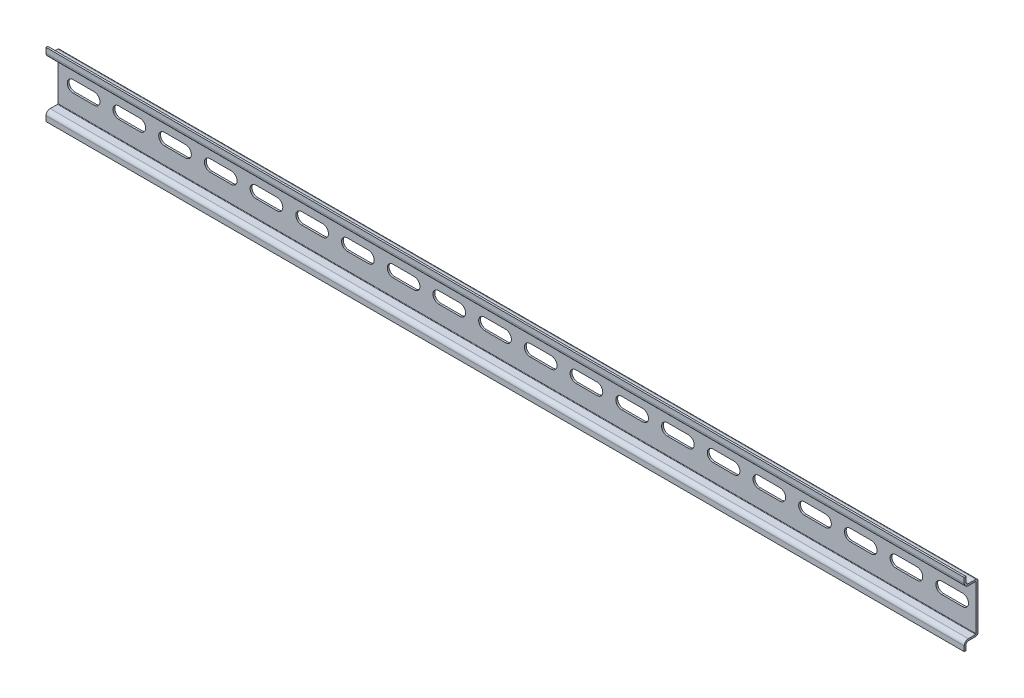
from build123d import *

# Parameters (mm, degrees)
STRUCTURAL_MEMBER1_DEPTH = 500
CUT_EXTRUDE1_REACH       = 252.724
LPATTERN1_DEPTH          = 1


# Read off the part's stored shape, not the designer's step: LPattern1
with BuildPart() as part:
    # Sketch2 → Structural Member1 (new body)
    with BuildSketch(Plane(origin=(-250, 0, 0), x_dir=(0, 0, -1), z_dir=(1, 0, 0))):
        with BuildLine():
            Line((0, 12.25), (0, -12.25))
            ThreePointArc((0, -12.25), (-0.366116524, -13.133883476), (-1.25, -13.5))
            Line((-1.25, -13.5), (-5.25, -13.5))
            ThreePointArc((-5.25, -13.5), (-6.133883476, -13.866116524), (-6.5, -14.75))
            Line((-6.5, -14.75), (-6.5, -17.5))
            Line((-6.5, -17.5), (-7.5, -17.5))
            Line((-7.5, -17.5), (-7.5, -14.75))
            ThreePointArc((-7.5, -14.75), (-6.840990258, -13.159009742), (-5.25, -12.5))
            Line((-5.25, -12.5), (-1.25, -12.5))
            ThreePointArc((-1.25, -12.5), (-1.073223305, -12.426776695), (-1, -12.25))
            Line((-1, -12.25), (-1, 12.25))
            ThreePointArc((-1, 12.25), (-1.073223305, 12.426776695), (-1.25, 12.5))
            Line((-1.25, 12.5), (-5.25, 12.5))
            ThreePointArc((-5.25, 12.5), (-6.840990258, 13.159009742), (-7.5, 14.75))
            Line((-7.5, 14.75), (-7.5, 17.5))
            Line((-7.5, 17.5), (-6.5, 17.5))
            Line((-6.5, 17.5), (-6.5, 14.75))
            ThreePointArc((-6.5, 14.75), (-6.133883476, 13.866116524), (-5.25, 13.5))
            Line((-5.25, 13.5), (-1.25, 13.5))
            ThreePointArc((-1.25, 13.5), (-0.366116524, 13.133883476), (0, 12.25))
        make_face()
    extrude(amount=STRUCTURAL_MEMBER1_DEPTH)

    # Sketch3 → Cut-Extrude1 (cut, up to next)
    with BuildSketch(Plane.XY, mode=Mode.PRIVATE) as cut_extrude1_sk1:
        with BuildLine():
            Line((-241.745, 3.175), (-230.315, 3.175))
            ThreePointArc((-230.315, 3.175), (-227.14, 0), (-230.315, -3.175))
            Line((-230.315, -3.175), (-241.745, -3.175))
            ThreePointArc((-241.745, -3.175), (-244.92, 0), (-241.745, 3.175))
        make_face()
    cut_extrude1_tool1 = extrude(cut_extrude1_sk1.sketch, amount=CUT_EXTRUDE1_REACH, mode=Mode.PRIVATE) & part.part
    add(cut_extrude1_tool1.solids().sort_by_distance((-236.03, 0, 0))[0], mode=Mode.SUBTRACT)

    # LPattern1 outline → LPattern1 (cut)
    with BuildSketch(Plane.XY):
        with BuildLine():
            Line((-216.853, -3.175), (-205.423, -3.175))
            ThreePointArc((-205.423, -3.175), (-202.248, 0), (-205.423, 3.175))
            Line((-205.423, 3.175), (-216.853, 3.175))
            ThreePointArc((-216.853, 3.175), (-220.028, 0), (-216.853, -3.175))
        make_face()
        with BuildLine():
            Line((-191.961, -3.175), (-180.531, -3.175))
            ThreePointArc((-180.531, -3.175), (-177.356, 0), (-180.531, 3.175))
            Line((-180.531, 3.175), (-191.961, 3.175))
            ThreePointArc((-191.961, 3.175), (-195.136, 0), (-191.961, -3.175))
        make_face()
        with BuildLine():
            Line((-167.069, -3.175), (-155.639, -3.175))
            ThreePointArc((-155.639, -3.175), (-152.464, 0), (-155.639, 3.175))
            Line((-155.639, 3.175), (-167.069, 3.175))
            ThreePointArc((-167.069, 3.175), (-170.244, 0), (-167.069, -3.175))
        make_face()
        with BuildLine():
            Line((-142.177, -3.175), (-130.747, -3.175))
            ThreePointArc((-130.747, -3.175), (-127.572, 0), (-130.747, 3.175))
            Line((-130.747, 3.175), (-142.177, 3.175))
            ThreePointArc((-142.177, 3.175), (-145.352, 0), (-142.177, -3.175))
        make_face()
        with BuildLine():
            Line((-117.285, -3.175), (-105.855, -3.175))
            ThreePointArc((-105.855, -3.175), (-102.68, 0), (-105.855, 3.175))
            Line((-105.855, 3.175), (-117.285, 3.175))
            ThreePointArc((-117.285, 3.175), (-120.46, 0), (-117.285, -3.175))
        make_face()
        with BuildLine():
            Line((-92.393, -3.175), (-80.963, -3.175))
            ThreePointArc((-80.963, -3.175), (-77.788, 0), (-80.963, 3.175))
            Line((-80.963, 3.175), (-92.393, 3.175))
            ThreePointArc((-92.393, 3.175), (-95.568, 0), (-92.393, -3.175))
        make_face()
        with BuildLine():
            Line((-67.501, -3.175), (-56.071, -3.175))
            ThreePointArc((-56.071, -3.175), (-52.896, 0), (-56.071, 3.175))
            Line((-56.071, 3.175), (-67.501, 3.175))
            ThreePointArc((-67.501, 3.175), (-70.676, 0), (-67.501, -3.175))
        make_face()
        with BuildLine():
            Line((-42.609, -3.175), (-31.179, -3.175))
            ThreePointArc((-31.179, -3.175), (-28.004, 0), (-31.179, 3.175))
            Line((-31.179, 3.175), (-42.609, 3.175))
            ThreePointArc((-42.609, 3.175), (-45.784, 0), (-42.609, -3.175))
        make_face()
        with BuildLine():
            Line((-17.717, -3.175), (-6.287, -3.175))
            ThreePointArc((-6.287, -3.175), (-3.112, 0), (-6.287, 3.175))
            Line((-6.287, 3.175), (-17.717, 3.175))
            ThreePointArc((-17.717, 3.175), (-20.892, 0), (-17.717, -3.175))
        make_face()
        with BuildLine():
            Line((7.175, -3.175), (18.605, -3.175))
            ThreePointArc((18.605, -3.175), (21.78, 0), (18.605, 3.175))
            Line((18.605, 3.175), (7.175, 3.175))
            ThreePointArc((7.175, 3.175), (4, 0), (7.175, -3.175))
        make_face()
        with BuildLine():
            Line((32.067, -3.175), (43.497, -3.175))
            ThreePointArc((43.497, -3.175), (46.672, 0), (43.497, 3.175))
            Line((43.497, 3.175), (32.067, 3.175))
            ThreePointArc((32.067, 3.175), (28.892, 0), (32.067, -3.175))
        make_face()
        with BuildLine():
            Line((56.959, -3.175), (68.389, -3.175))
            ThreePointArc((68.389, -3.175), (71.564, 0), (68.389, 3.175))
            Line((68.389, 3.175), (56.959, 3.175))
            ThreePointArc((56.959, 3.175), (53.784, 0), (56.959, -3.175))
        make_face()
        with BuildLine():
            Line((81.851, -3.175), (93.281, -3.175))
            ThreePointArc((93.281, -3.175), (96.456, 0), (93.281, 3.175))
            Line((93.281, 3.175), (81.851, 3.175))
            ThreePointArc((81.851, 3.175), (78.676, 0), (81.851, -3.175))
        make_face()
        with BuildLine():
            Line((106.743, -3.175), (118.173, -3.175))
            ThreePointArc((118.173, -3.175), (121.348, 0), (118.173, 3.175))
            Line((118.173, 3.175), (106.743, 3.175))
            ThreePointArc((106.743, 3.175), (103.568, 0), (106.743, -3.175))
        make_face()
        with BuildLine():
            Line((131.635, -3.175), (143.065, -3.175))
            ThreePointArc((143.065, -3.175), (146.24, 0), (143.065, 3.175))
            Line((143.065, 3.175), (131.635, 3.175))
            ThreePointArc((131.635, 3.175), (128.46, 0), (131.635, -3.175))
        make_face()
        with BuildLine():
            Line((156.527, -3.175), (167.957, -3.175))
            ThreePointArc((167.957, -3.175), (171.132, 0), (167.957, 3.175))
            Line((167.957, 3.175), (156.527, 3.175))
            ThreePointArc((156.527, 3.175), (153.352, 0), (156.527, -3.175))
        make_face()
        with BuildLine():
            Line((181.419, -3.175), (192.849, -3.175))
            ThreePointArc((192.849, -3.175), (196.024, 0), (192.849, 3.175))
            Line((192.849, 3.175), (181.419, 3.175))
            ThreePointArc((181.419, 3.175), (178.244, 0), (181.419, -3.175))
        make_face()
        with BuildLine():
            Line((206.311, -3.175), (217.741, -3.175))
            ThreePointArc((217.741, -3.175), (220.916, 0), (217.741, 3.175))
            Line((217.741, 3.175), (206.311, 3.175))
            ThreePointArc((206.311, 3.175), (203.136, 0), (206.311, -3.175))
        make_face()
        with BuildLine():
            Line((231.203, -3.175), (242.633, -3.175))
            ThreePointArc((242.633, -3.175), (245.808, 0), (242.633, 3.175))
            Line((242.633, 3.175), (231.203, 3.175))
            ThreePointArc((231.203, 3.175), (228.028, 0), (231.203, -3.175))
        make_face()
    extrude(amount=LPATTERN1_DEPTH, mode=Mode.SUBTRACT)


solid = part.part
